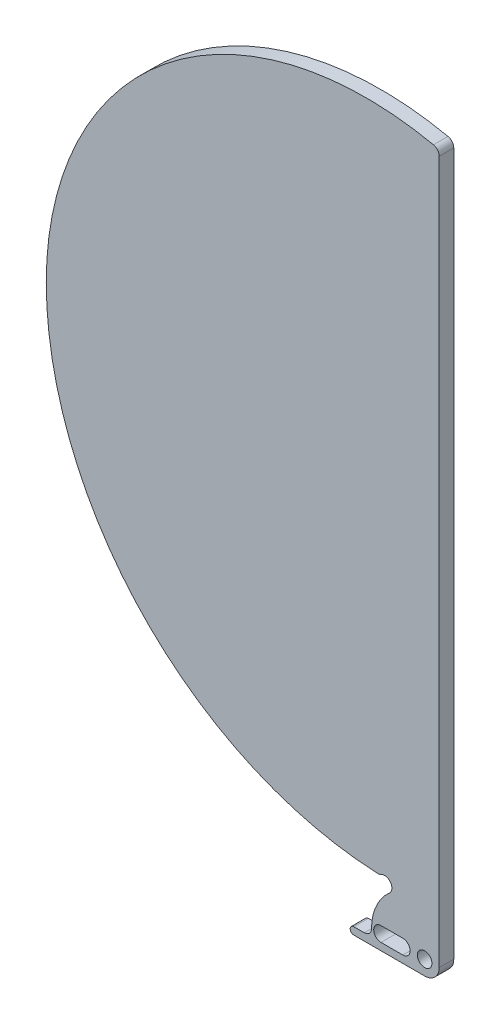
from build123d import *
from OCP.BRepFilletAPI import BRepFilletAPI_MakeFillet

# Parameters (mm, degrees)
SKETCH2_R           = 0.5
BOSS_EXTRUDE1_DEPTH = 0.5
FILLET1_R           = 0.5
FILLET1_R_2         = 0.25


with BuildPart() as part:
    # Sketch2 → Boss-Extrude1 (new, symmetric)
    with BuildSketch(Plane.XY):
        with BuildLine():
            Line((0, -1.5), (0, 47.174281802))
            ThreePointArc((0, 47.174281802), (-18.674791912, 42.983685528), (-26.999996608, 25.75))
            ThreePointArc((-26.999996608, 25.75), (-20.318377061, 9.259170115), (-4.081325301, 1.982518397))
            ThreePointArc((-4.081325301, 1.982518397), (-3.375535656, 1.939379355), (-3.418674699, 1.23358971))
            ThreePointArc((-3.418674699, 1.23358971), (-4.423027454, -0.232962886), (-4.615591238, -2))
            Line((-4.615591238, -2), (-6.115591238, -2))
            Line((-6.115591238, -2), (-6.115591238, -2.5))
            Line((-6.115591238, -2.5), (-1, -2.5))
            ThreePointArc((-1, -2.5), (-0.292893219, -2.207106781), (0, -1.5))
        make_face()
        with Locations((-1, -1.5)):
            Circle(SKETCH2_R, mode=Mode.SUBTRACT)
        with BuildLine():
            Line((-4, -1), (-2.5, -1))
            ThreePointArc((-2.5, -1), (-2, -1.5), (-2.5, -2))
            Line((-2.5, -2), (-4, -2))
            ThreePointArc((-4, -2), (-4.5, -1.5), (-4, -1))
        make_face(mode=Mode.SUBTRACT)
    extrude(amount=BOSS_EXTRUDE1_DEPTH, both=True)

    # Fillet1
    fillet1_edges_1 = [part.edges().sort_by_distance(p)[0] for p in [
        (-4.081325301, 1.982518397, 0),
        (-4.615591238, -2, 0),
        (0, 47.174281802, 0),
    ]]
    fillet1_edges_2 = [part.edges().sort_by_distance(p)[0] for p in [
        (-6.115591238, -2.5, 0),
        (-6.115591238, -2, 0),
    ]]
    fillet1 = BRepFilletAPI_MakeFillet(part.part.solid().wrapped)
    for e in fillet1_edges_1:
        fillet1.Add(FILLET1_R - 0.0001, e.wrapped)
    for e in fillet1_edges_2:
        fillet1.Add(FILLET1_R_2 - 0.0001, e.wrapped)
    add(Compound.cast(fillet1.Shape()), mode=Mode.REPLACE)  # a hair under: the kernel refuses the full size


solid = part.part
